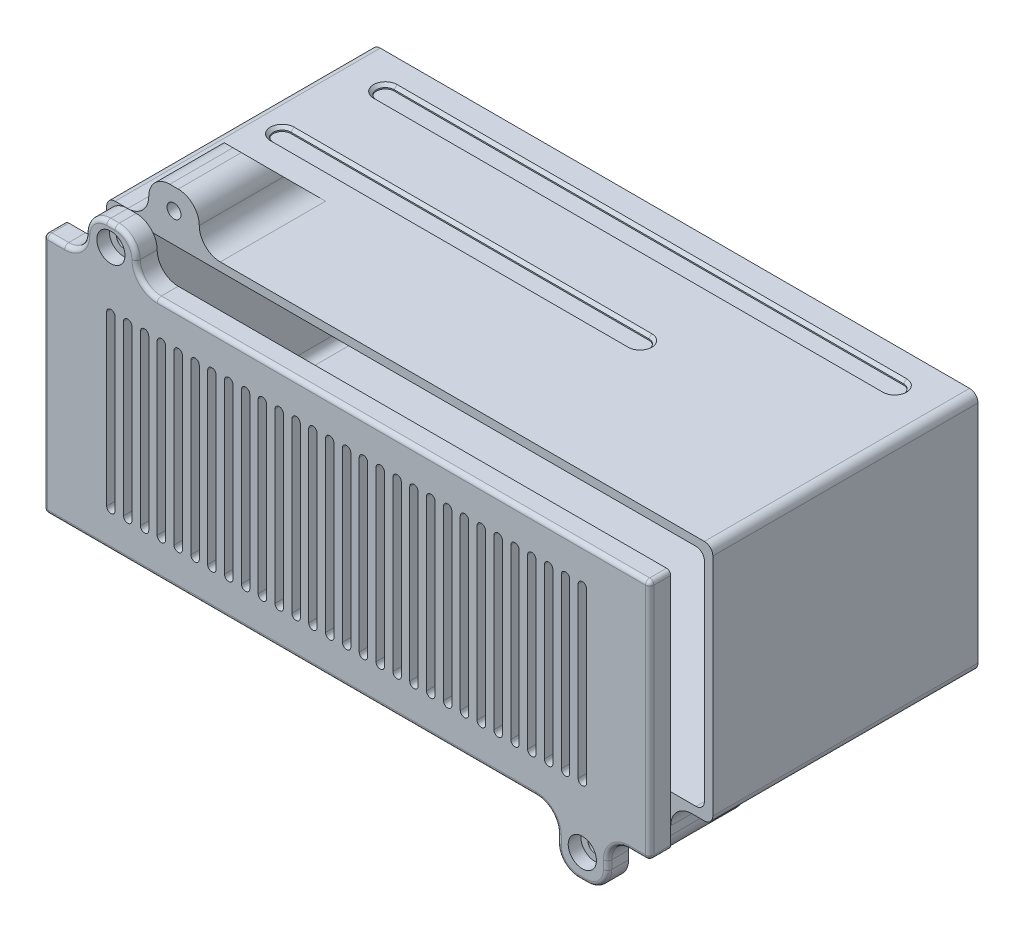
from build123d import *

# Parameters (mm, degrees)
SKETCH_1_W                = 144
SKETCH_1_H                = 57.5
EXTRUDE_1_DEPTH           = 67
CUT_EXTRUDE_START         = -5
SKETCH_2_W                = 140
SKETCH_2_H                = 53.5
CUT_EXTRUDE_1_DEPTH       = 98.467372856
SKETCH_3_R                = 5
EXTRUDE_2_DEPTH           = 8
CUT_EXTRUDE_2_DEPTH       = 6
SKETCH_5_R                = 1.75
CUT_EXTRUDE_4_DEPTH       = 103.467372856
SKETCH_15_W               = 12
SKETCH_15_H               = 12
EXTRUDE_4_DEPTH           = 25
CHAMFER_1_SIZE            = 10
CUT_EXTRUDE_9_DEPTH       = 107.459205802
CUT_EXTRUDE_9_DEPTH_BACK  = 25
SKETCH_17_R               = 1.65
CUT_EXTRUDE_10_DEPTH      = 21
FILLET_4_R                = 5
CUT_EXTRUDE_START_2       = -1
SKETCH_9_R                = 2
CUT_EXTRUDE_11_DEPTH      = 1
CUT_EXTRUDE_13_DEPTH      = 107.459205802
CUT_EXTRUDE_13_DEPTH_BACK = 107.459205802
CUT_EXTRUDE_14_DEPTH      = 107.459205802
EXTRUDE_5_DEPTH           = 3
EXTRUDE_5_DEPTH_BACK      = 15
CUT_EXTRUDE_15_DEPTH      = 107.459205802
CUT_EXTRUDE_START_3       = 2
CUT_EXTRUDE_16_DEPTH      = 2
SKETCH_25_W               = 52.627048612
SKETCH_25_H               = 3
EXTRUDE_6_DEPTH           = 1.6
SKETCH_26_W               = 6.080869006
SKETCH_26_H               = 2.6585681
CUT_EXTRUDE_17_DEPTH      = 3.8
EXTRUDE_7_DEPTH           = 5
CUT_EXTRUDE_START_4       = 5
SKETCH_27_3_R             = 1.65
CUT_EXTRUDE_18_DEPTH      = 5
SKETCH_27_4_W             = 135.6
SKETCH_27_4_H             = 49.1
CUT_EXTRUDE_19_DEPTH      = 3
SKETCH_27_5_W             = 139.6
SKETCH_27_5_H             = 53.1
SKETCH_27_5_W_2           = 135.6
SKETCH_27_5_H_2           = 49.1
EXTRUDE_8_DEPTH           = 1
FILLET_5_R                = 2
FILLET_6_R                = 1
CUT_EXTRUDE_21_DEPTH      = 1
CHAMFER_3_SIZE            = 0.7
SKETCH_27_9_R             = 3.35
CUT_EXTRUDE_22_DEPTH      = 11
SPLIT_BODIES_2_DEPTH      = 4
SPLIT_BODIES_2_2_DEPTH    = 2.024453747
FILLET_8_R                = 2


# Read off the part's stored shape, not the designer's step: Разделить2
# Some blends are built 0.0001 mm under size
with BuildPart() as part:
    # Эскиз1 → Бобышка-Вытянуть1 (new body)
    with BuildSketch(Plane.XY):
        Rectangle(SKETCH_1_W, SKETCH_1_H)
    extrude(amount=EXTRUDE_1_DEPTH)

    # Эскиз2 → Вырез-Вытянуть1 (cut, through all)
    with BuildSketch(Plane(origin=(0, 0, 0), x_dir=(-1, 0, 0), z_dir=(0, 0, -1)).offset(CUT_EXTRUDE_START)):
        Rectangle(SKETCH_2_W, SKETCH_2_H)
    extrude(amount=-CUT_EXTRUDE_1_DEPTH, mode=Mode.SUBTRACT)

    # Эскиз3 → Бобышка-Вытянуть2 (add)
    with BuildSketch(Plane(origin=(0, 0, 0), x_dir=(-1, 0, 0), z_dir=(0, 0, -1))):
        with Locations((66, -22)):
            Circle(SKETCH_3_R)
        with Locations((-66, -22)):
            Circle(SKETCH_3_R)
        with Locations((-66, 22)):
            Circle(SKETCH_3_R)
        with Locations((66, 22)):
            Circle(SKETCH_3_R)
    extrude(amount=-EXTRUDE_2_DEPTH)

    # Эскиз4 → Вырез-Вытянуть2 (cut)
    with BuildSketch(Plane(origin=(0, 0, 0), x_dir=(-1, 0, 0), z_dir=(0, 0, -1))):
        Polygon((-63.268024947, -20.755152361), (-65.712082153, -19.011616382), (-68.444057206, -20.256464022), (-68.731975053, -23.244847639), (-66.287917847, -24.988383618), (-63.555942794, -23.743535978), align=None)
        Polygon((63.002667596, -22.171265267), (64.64965387, -24.681398639), (67.646986274, -24.510133372), (68.997332404, -21.828734733), (67.35034613, -19.318601361), (64.353013726, -19.489866628), align=None)
        Polygon((63.002667596, 22.171265267), (64.353013726, 19.489866628), (67.35034613, 19.318601361), (68.997332404, 21.828734733), (67.646986274, 24.510133372), (64.64965387, 24.681398639), align=None)
        Polygon((-63.002667596, 22.171265267), (-64.64965387, 24.681398639), (-67.646986274, 24.510133372), (-68.997332404, 21.828734733), (-67.35034613, 19.318601361), (-64.353013726, 19.489866628), align=None)
    extrude(amount=-CUT_EXTRUDE_2_DEPTH, mode=Mode.SUBTRACT)

    # Эскиз5 → Вырез-Вытянуть4 (cut, through all)
    with BuildSketch(Plane(origin=(0, 0, 0), x_dir=(-1, 0, 0), z_dir=(0, 0, -1))):
        with Locations((-66, 22)):
            Circle(SKETCH_5_R)
        with Locations((-66, -22)):
            Circle(SKETCH_5_R)
        with Locations((66, -22)):
            Circle(SKETCH_5_R)
        with Locations((66, 22)):
            Circle(SKETCH_5_R)
    extrude(amount=-CUT_EXTRUDE_4_DEPTH, mode=Mode.SUBTRACT)

    # Эскиз15 → Бобышка-Вытянуть4 (add)
    with BuildSketch(Plane.XY.offset(67)):
        with Locations((56, -34.75)):
            Rectangle(SKETCH_15_W, SKETCH_15_H)
        with Locations((-56, 32.75)):
            Rectangle(SKETCH_15_W, SKETCH_15_H)
    extrude(amount=-EXTRUDE_4_DEPTH)

    # Фаска1
    chamfer_1_edges = [part.edges().sort_by_distance(p)[0] for p in [
        (-56, 38.75, 42),
        (56, -40.75, 42),
    ]]
    chamfer(chamfer_1_edges, length=CHAMFER_1_SIZE - 0.0001)  # a hair under: the kernel refuses the full size

    # Эскиз17 → Вырез-Вытянуть9 (cut, two sides: drawn at the far end of the back side and taken through both)
    with BuildSketch(Plane.XY.offset(67).offset(-CUT_EXTRUDE_9_DEPTH_BACK)):
        with Locations(Location((56, -34.75, 0), (0, 0, 90))):
            Circle(SKETCH_17_R)
        with Locations(Location((-56, 33.75, 0), (0, 0, 270))):
            Circle(SKETCH_17_R)
    extrude(amount=CUT_EXTRUDE_9_DEPTH + CUT_EXTRUDE_9_DEPTH_BACK, mode=Mode.SUBTRACT)

    # Эскиз18 → Вырез-Вытянуть10 (cut)
    with BuildSketch(Plane.XY.offset(67).offset(CUT_EXTRUDE_START)):
        Polygon((57.569806753, -32.190890762), (54.568649766, -32.110952854), (52.998843012, -34.670062091), (54.430193247, -37.309109238), (57.431350234, -37.389047146), (59.001156988, -34.829937909), align=None)
        Polygon((-57.5011107, 35.35), (-59.0022214, 32.75), (-57.5011107, 30.15), (-54.4988893, 30.15), (-52.9977786, 32.75), (-54.4988893, 35.35), align=None)
    extrude(amount=-CUT_EXTRUDE_10_DEPTH, mode=Mode.SUBTRACT)

    # Скругление4
    # the kernel refuses this fillet: 5 mm, written as the material it adds along each edge
    with BuildSketch(Plane(origin=(62, -28.75, 67), x_dir=(0, -1, 0), z_dir=(0, 0, -1))) as fillet_4_piece_1_section:
        with BuildLine():
            CenterArc((FILLET_4_R, -FILLET_4_R), FILLET_4_R, 90, 90)
            Line((0, -FILLET_4_R), (0, 0))
            Line((0, 0), (FILLET_4_R, 0))
        make_face()
    fillet_4_piece_1 = extrude(amount=25, mode=Mode.PRIVATE)
    fillet_4_piece_1 = split(fillet_4_piece_1, bisect_by=Plane(origin=(63.139504499, -36.600167795, 47.850067795), z_dir=(0, 0.7071067811865474, 0.7071067811865477)), keep=Keep.TOP, mode=Mode.PRIVATE)
    add(fillet_4_piece_1)
    with BuildSketch(Plane(origin=(50, -28.75, 67), x_dir=(-1, 0, 0), z_dir=(0, 0, -1))) as fillet_4_piece_2_section:
        with BuildLine():
            CenterArc((FILLET_4_R, -FILLET_4_R), FILLET_4_R, 90, 90)
            Line((0, -FILLET_4_R), (0, 0))
            Line((0, 0), (FILLET_4_R, 0))
        make_face()
    fillet_4_piece_2 = extrude(amount=25, mode=Mode.PRIVATE)
    fillet_4_piece_2 = split(fillet_4_piece_2, bisect_by=Plane(origin=(48.860495501, -36.600167796, 47.850067796), z_dir=(0, 0.7071067811865474, 0.7071067811865477)), keep=Keep.TOP, mode=Mode.PRIVATE)
    add(fillet_4_piece_2)
    with BuildSketch(Plane(origin=(-50, 28.75, 29.5), x_dir=(1, 0, 0), z_dir=(0, 0, 1))) as fillet_4_piece_3_section:
        with BuildLine():
            CenterArc((FILLET_4_R, FILLET_4_R), FILLET_4_R, 180, 90)
            Line((0, FILLET_4_R), (0, 0))
            Line((0, 0), (FILLET_4_R, 0))
        make_face()
    fillet_4_piece_3 = extrude(amount=37.5, mode=Mode.PRIVATE)
    fillet_4_piece_3 = split(fillet_4_piece_3, bisect_by=Plane(origin=(-47.550000008, 28.70005, 41.94995), z_dir=(0, -0.7071067811865474, 0.7071067811865477)), keep=Keep.TOP, mode=Mode.PRIVATE)
    add(fillet_4_piece_3)
    with BuildSketch(Plane(origin=(-62, 28.75, 67), x_dir=(-1, 0, 0), z_dir=(0, 0, -1))) as fillet_4_piece_4_section:
        with BuildLine():
            CenterArc((FILLET_4_R, FILLET_4_R), FILLET_4_R, 180, 90)
            Line((0, FILLET_4_R), (0, 0))
            Line((0, 0), (FILLET_4_R, 0))
        make_face()
    fillet_4_piece_4 = extrude(amount=37.5, mode=Mode.PRIVATE)
    fillet_4_piece_4 = split(fillet_4_piece_4, bisect_by=Plane(origin=(-63.160517803, 35.813690722, 49.063590722), z_dir=(0, -0.7071067811865474, 0.7071067811865477)), keep=Keep.TOP, mode=Mode.PRIVATE)
    add(fillet_4_piece_4)
    # the kernel refuses this fillet: 5 mm, written as the material it takes off along each edge
    with BuildSketch(Plane(origin=(-62, 38.75, 79.5), x_dir=(1, 0, 0), z_dir=(0, 0, -1)), Plane(origin=(-50, 38.75, 79.5), x_dir=(0, -1, 0), z_dir=(0, 0, -1))) as fillet_4_2_piece_1:
        with BuildLine():
            CenterArc((FILLET_4_R, FILLET_4_R), FILLET_4_R, 180, 90)
            Line((0, FILLET_4_R), (0, 0))
            Line((0, 0), (FILLET_4_R, 0))
        make_face()
    extrude(amount=40.0001, mode=Mode.SUBTRACT)
    with BuildSketch(Plane(origin=(62, -40.75, 79.5), x_dir=(0, 1, 0), z_dir=(0, 0, -1)), Plane(origin=(50, -40.75, 79.5), x_dir=(1, 0, 0), z_dir=(0, 0, -1))) as fillet_4_2_piece_2:
        with BuildLine():
            CenterArc((FILLET_4_R, -FILLET_4_R), FILLET_4_R, 90, 90)
            Line((0, -FILLET_4_R), (0, 0))
            Line((0, 0), (FILLET_4_R, 0))
        make_face()
    extrude(amount=40.0001, mode=Mode.SUBTRACT)

    # Эскиз9 → Вырез-Вытянуть11 (cut)
    with BuildSketch(Plane.XZ.offset(-26.75).offset(CUT_EXTRUDE_START_2)):
        with Locations(Location((-60.5, 12.3, 0), (0, 0, 270))):
            Circle(SKETCH_9_R)
        with Locations(Location((-55.5, 12.3, 0), (0, 0, 270))):
            Circle(SKETCH_9_R)
        with Locations(Location((-50.5, 12.3, 0), (0, 0, 270))):
            Circle(SKETCH_9_R)
        with Locations(Location((-45.5, 12.3, 0), (0, 0, 270))):
            Circle(SKETCH_9_R)
        with Locations(Location((-40.5, 12.3, 0), (0, 0, 270))):
            Circle(SKETCH_9_R)
        with Locations(Location((-35.5, 12.3, 0), (0, 0, 270))):
            Circle(SKETCH_9_R)
        with Locations(Location((-64, 33.3, 0), (0, 0, 270))):
            Circle(SKETCH_9_R)
        with Locations(Location((-59, 33.3, 0), (0, 0, 270))):
            Circle(SKETCH_9_R)
        with Locations(Location((-28.5, 12.3, 0), (0, 0, 270))):
            Circle(SKETCH_9_R)
        with Locations(Location((-23.5, 12.3, 0), (0, 0, 270))):
            Circle(SKETCH_9_R)
        with Locations(Location((-18.5, 12.3, 0), (0, 0, 270))):
            Circle(SKETCH_9_R)
        with Locations(Location((-13.5, 12.3, 0), (0, 0, 270))):
            Circle(SKETCH_9_R)
        with Locations(Location((-8.5, 12.3, 0), (0, 0, 270))):
            Circle(SKETCH_9_R)
        with Locations(Location((-3.5, 12.3, 0), (0, 0, 270))):
            Circle(SKETCH_9_R)
        with Locations(Location((3.5, 12.3, 0), (0, 0, 270))):
            Circle(SKETCH_9_R)
        with Locations(Location((8.5, 12.3, 0), (0, 0, 270))):
            Circle(SKETCH_9_R)
        with Locations(Location((13.5, 12.3, 0), (0, 0, 270))):
            Circle(SKETCH_9_R)
        with Locations(Location((18.5, 12.3, 0), (0, 0, 270))):
            Circle(SKETCH_9_R)
        with Locations(Location((23.5, 12.3, 0), (0, 0, 270))):
            Circle(SKETCH_9_R)
        with Locations(Location((28.5, 12.3, 0), (0, 0, 270))):
            Circle(SKETCH_9_R)
        with Locations(Location((35.5, 12.3, 0), (0, 0, 270))):
            Circle(SKETCH_9_R)
        with Locations(Location((40.5, 12.3, 0), (0, 0, 270))):
            Circle(SKETCH_9_R)
        with Locations(Location((45.5, 12.3, 0), (0, 0, 270))):
            Circle(SKETCH_9_R)
        with Locations(Location((50.5, 12.3, 0), (0, 0, 270))):
            Circle(SKETCH_9_R)
        with Locations(Location((55.5, 12.3, 0), (0, 0, 270))):
            Circle(SKETCH_9_R)
        with Locations(Location((60.5, 12.3, 0), (0, 0, 270))):
            Circle(SKETCH_9_R)
        with Locations(Location((-54, 33.3, 0), (0, 0, 270))):
            Circle(SKETCH_9_R)
        with Locations(Location((-49, 33.3, 0), (0, 0, 270))):
            Circle(SKETCH_9_R)
        with Locations(Location((-44, 33.3, 0), (0, 0, 270))):
            Circle(SKETCH_9_R)
        with Locations(Location((-39, 33.3, 0), (0, 0, 270))):
            Circle(SKETCH_9_R)
        with Locations(Location((-34, 33.3, 0), (0, 0, 270))):
            Circle(SKETCH_9_R)
        with Locations(Location((-29, 33.3, 0), (0, 0, 270))):
            Circle(SKETCH_9_R)
        with Locations(Location((-24, 33.3, 0), (0, 0, 270))):
            Circle(SKETCH_9_R)
        with Locations(Location((-19, 33.3, 0), (0, 0, 270))):
            Circle(SKETCH_9_R)
        with Locations(Location((-14, 33.3, 0), (0, 0, 270))):
            Circle(SKETCH_9_R)
        with Locations(Location((-9, 33.3, 0), (0, 0, 270))):
            Circle(SKETCH_9_R)
        with Locations(Location((-4, 33.3, 0), (0, 0, 270))):
            Circle(SKETCH_9_R)
        with Locations(Location((1, 33.3, 0), (0, 0, 270))):
            Circle(SKETCH_9_R)
        with Locations(Location((6, 33.3, 0), (0, 0, 270))):
            Circle(SKETCH_9_R)
        with Locations(Location((11, 33.3, 0), (0, 0, 270))):
            Circle(SKETCH_9_R)
        with Locations(Location((16, 33.3, 0), (0, 0, 270))):
            Circle(SKETCH_9_R)
        with Locations(Location((21, 33.3, 0), (0, 0, 270))):
            Circle(SKETCH_9_R)
    extrude(amount=-CUT_EXTRUDE_11_DEPTH, mode=Mode.SUBTRACT)

    # Эскиз19 → Вырез-Вытянуть13 (cut, two sides: drawn at the far end of the back side and taken through both)
    with BuildSketch(Plane(origin=(0, 0, 0), x_dir=(0, 0, -1), z_dir=(1, 0, 0)).offset(-CUT_EXTRUDE_13_DEPTH_BACK)):
        Polygon((0, -17.5), (-4, -17.5), (-4, 17.5), (-2, 17.5), (-2, 15.5), (-1, 14.5), (0, 14.5), align=None)
    extrude(amount=CUT_EXTRUDE_13_DEPTH + CUT_EXTRUDE_13_DEPTH_BACK, mode=Mode.SUBTRACT)

    # Эскиз20 → Вырез-Вытянуть14 (cut, through all)
    with BuildSketch(Plane(origin=(0, 0, 0), x_dir=(1, 0, 0), z_dir=(0, 1, 0))):
        Polygon((-25, -4), (-40, -4), (-40, -2.024453747), (-38, -2), (-38, 0), (-27, 0), (-27, -2), (-25, -2), align=None)
        Polygon((25, -2), (25, -4), (40, -4), (40, -2.024453747), (38, -2), (38, 0), (27, 0), (27, -2), align=None)
    extrude(amount=-CUT_EXTRUDE_14_DEPTH, mode=Mode.SUBTRACT)


with BuildPart() as body_2:
    # Эскиз21 → Бобышка-Вытянуть5 (new, two sides: drawn at the far end of the back side and taken through both)
    with BuildSketch(Plane.XZ.offset(28.75).offset(-EXTRUDE_5_DEPTH_BACK)):
        Polygon((37.772951388, 0), (27.2, 0), (27.2, 2.2), (25.2, 2.2), (25.2, 3.8), (39.819562997, 3.8), (39.8, 2.2), (37.799850509, 2.2), align=None)
    extrude(amount=EXTRUDE_5_DEPTH + EXTRUDE_5_DEPTH_BACK)

    # Эскиз22 → Вырез-Вытянуть15 (cut, through all)
    with BuildSketch(Plane(origin=(0, 0, 0), x_dir=(0, 0, -1), z_dir=(1, 0, 0))):
        Polygon((-2.2, -13.75), (-2.2, -15.84568202), (-4, -15.84568202), (-4, -11.595293693), (1.365124621, -11.595293693), (1.365124621, -15.500130707), (0, -15.500130707), (-1.535688468, -13.75), align=None)
    extrude(amount=CUT_EXTRUDE_15_DEPTH, mode=Mode.SUBTRACT)


with BuildPart() as cut_extrude_16_tool:
    # Эскиз24 → Вырез-Вытянуть16 (new body)
    with BuildSketch(Plane.XY.offset(CUT_EXTRUDE_START_3)):
        Polygon((39.8, -27.25), (39.8, -19), (59.8, -21.625), (59.8, -24.625), align=None)
        Polygon((25.172951388, -27.25), (25.172951388, -19), (5.172951388, -21.625), (5.172951388, -24.625), align=None)
        Polygon((-25.172951388, -27.25), (-25.172951388, -19), (-5.172951388, -21.625), (-5.172951388, -24.625), align=None)
        Polygon((-39.8, -27.25), (-39.8, -19), (-59.8, -21.625), (-59.8, -24.625), align=None)
    extrude(amount=CUT_EXTRUDE_16_DEPTH)


with BuildPart() as part_1:
    add(part.part)

    # Вырез-Вытянуть16: cut by cut_extrude_16_tool
    add(cut_extrude_16_tool.part, mode=Mode.SUBTRACT)

    # Скругление5
    # the kernel refuses this fillet: 2 mm, written as the material it adds along each edge
    with BuildSketch(Plane(origin=(70, -26.75, 0), x_dir=(0, 1, 0), z_dir=(0, 0, 1)), Plane(origin=(-70, -26.75, 0), x_dir=(1, 0, 0), z_dir=(0, 0, 1))) as fillet_5_piece_1:
        with BuildLine():
            CenterArc((FILLET_5_R, FILLET_5_R), FILLET_5_R, 180, 90)
            Line((0, FILLET_5_R), (0, 0))
            Line((0, 0), (FILLET_5_R, 0))
        make_face()
    extrude(amount=67)
    with BuildSketch(Plane(origin=(-70, 26.75, 0), x_dir=(1, 0, 0), z_dir=(0, 0, 1)), Plane(origin=(70, 26.75, 0), x_dir=(0, -1, 0), z_dir=(0, 0, 1))) as fillet_5_piece_2:
        with BuildLine():
            CenterArc((FILLET_5_R, -FILLET_5_R), FILLET_5_R, 90, 90)
            Line((0, -FILLET_5_R), (0, 0))
            Line((0, 0), (FILLET_5_R, 0))
        make_face()
    extrude(amount=67)
    # the kernel refuses this fillet: 2 mm, written as the material it takes off along each edge
    with BuildSketch(Plane(origin=(72, -28.75, -5), x_dir=(0, 1, 0), z_dir=(0, 0, 1)), Plane(origin=(-72, -28.75, -5), x_dir=(1, 0, 0), z_dir=(0, 0, 1)), Plane(origin=(72, 28.75, -5), x_dir=(-1, 0, 0), z_dir=(0, 0, 1))) as fillet_5_2_piece_1:
        with BuildLine():
            CenterArc((FILLET_5_R, FILLET_5_R), FILLET_5_R, 180, 90)
            Line((0, FILLET_5_R), (0, 0))
            Line((0, 0), (FILLET_5_R, 0))
        make_face()
    extrude(amount=77, mode=Mode.SUBTRACT)
    with BuildSketch(Plane(origin=(-72, 28.75, -5), x_dir=(1, 0, 0), z_dir=(0, 0, 1))) as fillet_5_2_piece_2:
        with BuildLine():
            CenterArc((FILLET_5_R, -FILLET_5_R), FILLET_5_R, 90, 90)
            Line((0, -FILLET_5_R), (0, 0))
            Line((0, 0), (FILLET_5_R, 0))
        make_face()
    extrude(amount=77, mode=Mode.SUBTRACT)

    # Эскиз28 → Вырез-Вытянуть21 (cut)
    with BuildSketch(Plane(origin=(0, 28.75, 0), x_dir=(1, 0, 0), z_dir=(0, 1, 0))):
        with BuildLine():
            Line((60.5, -14.4), (-60.5, -14.4))
            ThreePointArc((-60.5, -14.4), (-62.6, -12.3), (-60.5, -10.2))
            Line((-60.5, -10.2), (60.5, -10.2))
            ThreePointArc((60.5, -10.2), (62.6, -12.3), (60.5, -14.4))
        make_face()
        with BuildLine():
            Line((21, -35.4), (-64, -35.4))
            ThreePointArc((-64, -35.4), (-66.1, -33.3), (-64, -31.2))
            Line((-64, -31.2), (21, -31.2))
            ThreePointArc((21, -31.2), (23.1, -33.3), (21, -35.4))
        make_face()
    extrude(amount=-CUT_EXTRUDE_21_DEPTH, mode=Mode.SUBTRACT)

    # Фаска3
    chamfer_3_edges = [part_1.edges().sort_by_distance(p)[0] for p in [
        (62.6, 28.75, 12.3),
        (0, 28.75, 10.2),
        (-62.6, 28.75, 12.3),
        (0, 28.75, 14.4),
        (23.1, 28.75, 33.3),
        (-21.5, 28.75, 31.2),
        (-66.1, 28.75, 33.3),
        (-21.5, 28.75, 35.4),
    ]]
    chamfer(chamfer_3_edges, length=CHAMFER_3_SIZE)

    # Split Bodies 2 outline → Split Bodies 2 (cut)
    # profile 1 of 4: a face of its own
    with BuildSketch(Plane.XY):
        Polygon((-27, -17.5), (-27, -28.75), (25, -28.75), (25, -27.22730013), (5.172951388, -24.625), (5.172951388, -21.625), (25, -19.02269987), (25, -17.5), align=None)
    # profile 2 of 4: a face of its own
    with BuildSketch(Plane.XY):
        with BuildLine():
            Line((-38, -28.75), (-38, -17.5))
            Line((-38, -17.5), (-72, -17.5))
            Line((-72, -17.5), (-72, -26.75))
            ThreePointArc((-72, -26.75), (-71.414213562, -28.164213562), (-70, -28.75))
            Line((-70, -28.75), (-38, -28.75))
        make_face()
        Polygon((-64.64965387, -24.681398639), (-67.646986274, -24.510133372), (-68.997332404, -21.828734733), (-67.35034613, -19.318601361), (-64.353013726, -19.489866628), (-63.002667596, -22.171265267), align=None, mode=Mode.SUBTRACT)
    # profile 3 of 4: a face of its own
    with BuildSketch(Plane.XY):
        with BuildLine():
            Line((40, -27.22375), (40, -28.75))
            Line((40, -28.75), (70, -28.75))
            ThreePointArc((70, -28.75), (71.414213562, -28.164213562), (72, -26.75))
            Line((72, -26.75), (72, -17.5))
            Line((72, -17.5), (40, -17.5))
            Line((40, -17.5), (40, -19.02625))
            Line((40, -19.02625), (59.8, -21.625))
            Line((59.8, -21.625), (59.8, -24.625))
            Line((59.8, -24.625), (40, -27.22375))
        make_face()
        Polygon((63.555942794, -23.743535978), (63.268024947, -20.755152361), (65.712082153, -19.011616382), (68.444057206, -20.256464022), (68.731975053, -23.244847639), (66.287917847, -24.988383618), align=None, mode=Mode.SUBTRACT)
    # profile 4 of 4: a face of its own
    with BuildSketch(Plane.XY):
        with BuildLine():
            Line((-72, 14.5), (72, 14.5))
            Line((72, 14.5), (72, 26.75))
            ThreePointArc((72, 26.75), (71.414213562, 28.164213562), (70, 28.75))
            Line((70, 28.75), (-70, 28.75))
            ThreePointArc((-70, 28.75), (-71.414213562, 28.164213562), (-72, 26.75))
            Line((-72, 26.75), (-72, 14.5))
        make_face()
        Polygon((63.002667596, 22.171265267), (64.64965387, 24.681398639), (67.646986274, 24.510133372), (68.997332404, 21.828734733), (67.35034613, 19.318601361), (64.353013726, 19.489866628), align=None, mode=Mode.SUBTRACT)
        Polygon((-64.64965387, 24.681398639), (-63.002667596, 22.171265267), (-64.353013726, 19.489866628), (-67.35034613, 19.318601361), (-68.997332404, 21.828734733), (-67.646986274, 24.510133372), align=None, mode=Mode.SUBTRACT)
    extrude(amount=SPLIT_BODIES_2_DEPTH, mode=Mode.SUBTRACT)

    # Split Bodies 2 2 outline → Split Bodies 2 2 (cut)
    with BuildSketch(Plane.XY):
        Polygon((25, -27.22730013), (25, -28.75), (27, -28.75), (27, -17.5), (25, -17.5), (25, -19.02269987), (5.172951388, -21.625), (5.172951388, -24.625), align=None)
        Polygon((38, -17.5), (38, -28.75), (40, -28.75), (40, -27.22375), (59.8, -24.625), (59.8, -21.625), (40, -19.02625), (40, -17.5), align=None)
    extrude(amount=SPLIT_BODIES_2_2_DEPTH, mode=Mode.SUBTRACT)


with BuildPart() as body_2_1:
    add(body_2.part)

    # Вырез-Вытянуть16: cut by cut_extrude_16_tool
    add(cut_extrude_16_tool.part, mode=Mode.SUBTRACT)

    # Эскиз25 → Бобышка-Вытянуть6 (add)
    with BuildSketch(Plane(origin=(0, 0, 2.2), x_dir=(-1, 0, 0), z_dir=(0, 0, -1))):
        with Locations((-32.486475694, -23.125)):
            Rectangle(SKETCH_25_W, SKETCH_25_H)
    extrude(amount=-EXTRUDE_6_DEPTH)

    # Эскиз26 → Вырез-Вытянуть17 (cut)
    with BuildSketch(Plane(origin=(0, 0, 0), x_dir=(-1, 0, 0), z_dir=(0, 0, -1))):
        with Locations((-32.486475694, -28.670303883)):
            Rectangle(SKETCH_26_W, SKETCH_26_H)
    extrude(amount=-CUT_EXTRUDE_17_DEPTH, mode=Mode.SUBTRACT)


with BuildPart() as body_3:
    # Эскиз27 → Бобышка-Вытянуть7 (new body)
    with BuildSketch(Plane.XY.offset(77)):
        with BuildLine():
            Line((-67, 28.75), (-72, 28.75))
            Line((-72, 28.75), (-72, -28.75))
            Line((-72, -28.75), (45, -28.75))
            ThreePointArc((45, -28.75), (48.535533906, -30.214466094), (50, -33.75))
            Line((50, -33.75), (50, -35.75))
            ThreePointArc((50, -35.75), (51.464466094, -39.285533906), (55, -40.75))
            Line((55, -40.75), (57, -40.75))
            ThreePointArc((57, -40.75), (60.535533906, -39.285533906), (62, -35.75))
            Line((62, -35.75), (62, -33.75))
            ThreePointArc((62, -33.75), (63.464466094, -30.214466094), (67, -28.75))
            Line((67, -28.75), (72, -28.75))
            Line((72, -28.75), (72, 28.75))
            Line((72, 28.75), (-45, 28.75))
            ThreePointArc((-45, 28.75), (-48.535533906, 30.214466094), (-50, 33.75))
            ThreePointArc((-50, 33.75), (-51.464466094, 37.285533906), (-55, 38.75))
            Line((-55, 38.75), (-57, 38.75))
            ThreePointArc((-57, 38.75), (-60.535533906, 37.285533906), (-62, 33.75))
            ThreePointArc((-62, 33.75), (-63.464466094, 30.214466094), (-67, 28.75))
        make_face()
    extrude(amount=EXTRUDE_7_DEPTH)

    # Эскиз27<3> → Вырез-Вытянуть18 (cut)
    with BuildSketch(Plane.XY.offset(77).offset(CUT_EXTRUDE_START_4)):
        with Locations((56, -34.75)):
            Circle(SKETCH_27_3_R)
        with Locations((-56, 33.75)):
            Circle(SKETCH_27_3_R)
        with BuildLine():
            Line((1, 20), (1, -20))
            ThreePointArc((1, -20), (0, -21), (-1, -20))
            Line((-1, -20), (-1, 20))
            ThreePointArc((-1, 20), (0, 21), (1, 20))
        make_face()
        with BuildLine():
            Line((5, 20), (5, -20))
            ThreePointArc((5, -20), (4, -21), (3, -20))
            Line((3, -20), (3, 20))
            ThreePointArc((3, 20), (4, 21), (5, 20))
        make_face()
        with BuildLine():
            Line((9, 20), (9, -20))
            ThreePointArc((9, -20), (8, -21), (7, -20))
            Line((7, -20), (7, 20))
            ThreePointArc((7, 20), (8, 21), (9, 20))
        make_face()
        with BuildLine():
            Line((13, 20), (13, -20))
            ThreePointArc((13, -20), (12, -21), (11, -20))
            Line((11, -20), (11, 20))
            ThreePointArc((11, 20), (12, 21), (13, 20))
        make_face()
        with BuildLine():
            Line((17, 20), (17, -20))
            ThreePointArc((17, -20), (16, -21), (15, -20))
            Line((15, -20), (15, 20))
            ThreePointArc((15, 20), (16, 21), (17, 20))
        make_face()
        with BuildLine():
            Line((21, 20), (21, -20))
            ThreePointArc((21, -20), (20, -21), (19, -20))
            Line((19, -20), (19, 20))
            ThreePointArc((19, 20), (20, 21), (21, 20))
        make_face()
        with BuildLine():
            Line((25, 20), (25, -20))
            ThreePointArc((25, -20), (24, -21), (23, -20))
            Line((23, -20), (23, 20))
            ThreePointArc((23, 20), (24, 21), (25, 20))
        make_face()
        with BuildLine():
            Line((29, 20), (29, -20))
            ThreePointArc((29, -20), (28, -21), (27, -20))
            Line((27, -20), (27, 20))
            ThreePointArc((27, 20), (28, 21), (29, 20))
        make_face()
        with BuildLine():
            Line((33, 20), (33, -20))
            ThreePointArc((33, -20), (32, -21), (31, -20))
            Line((31, -20), (31, 20))
            ThreePointArc((31, 20), (32, 21), (33, 20))
        make_face()
        with BuildLine():
            Line((37, 20), (37, -20))
            ThreePointArc((37, -20), (36, -21), (35, -20))
            Line((35, -20), (35, 20))
            ThreePointArc((35, 20), (36, 21), (37, 20))
        make_face()
        with BuildLine():
            Line((41, 20), (41, -20))
            ThreePointArc((41, -20), (40, -21), (39, -20))
            Line((39, -20), (39, 20))
            ThreePointArc((39, 20), (40, 21), (41, 20))
        make_face()
        with BuildLine():
            Line((45, 20), (45, -20))
            ThreePointArc((45, -20), (44, -21), (43, -20))
            Line((43, -20), (43, 20))
            ThreePointArc((43, 20), (44, 21), (45, 20))
        make_face()
        with BuildLine():
            Line((49, 20), (49, -20))
            ThreePointArc((49, -20), (48, -21), (47, -20))
            Line((47, -20), (47, 20))
            ThreePointArc((47, 20), (48, 21), (49, 20))
        make_face()
        with BuildLine():
            Line((53, 20), (53, -20))
            ThreePointArc((53, -20), (52, -21), (51, -20))
            Line((51, -20), (51, 20))
            ThreePointArc((51, 20), (52, 21), (53, 20))
        make_face()
        with BuildLine():
            Line((57, 20), (57, -20))
            ThreePointArc((57, -20), (56, -21), (55, -20))
            Line((55, -20), (55, 20))
            ThreePointArc((55, 20), (56, 21), (57, 20))
        make_face()
        with BuildLine():
            Line((-3, 20), (-3, -20))
            ThreePointArc((-3, -20), (-4, -21), (-5, -20))
            Line((-5, -20), (-5, 20))
            ThreePointArc((-5, 20), (-4, 21), (-3, 20))
        make_face()
        with BuildLine():
            Line((-7, 20), (-7, -20))
            ThreePointArc((-7, -20), (-8, -21), (-9, -20))
            Line((-9, -20), (-9, 20))
            ThreePointArc((-9, 20), (-8, 21), (-7, 20))
        make_face()
        with BuildLine():
            Line((-11, 20), (-11, -20))
            ThreePointArc((-11, -20), (-12, -21), (-13, -20))
            Line((-13, -20), (-13, 20))
            ThreePointArc((-13, 20), (-12, 21), (-11, 20))
        make_face()
        with BuildLine():
            Line((-15, 20), (-15, -20))
            ThreePointArc((-15, -20), (-16, -21), (-17, -20))
            Line((-17, -20), (-17, 20))
            ThreePointArc((-17, 20), (-16, 21), (-15, 20))
        make_face()
        with BuildLine():
            Line((-19, 20), (-19, -20))
            ThreePointArc((-19, -20), (-20, -21), (-21, -20))
            Line((-21, -20), (-21, 20))
            ThreePointArc((-21, 20), (-20, 21), (-19, 20))
        make_face()
        with BuildLine():
            Line((-23, 20), (-23, -20))
            ThreePointArc((-23, -20), (-24, -21), (-25, -20))
            Line((-25, -20), (-25, 20))
            ThreePointArc((-25, 20), (-24, 21), (-23, 20))
        make_face()
        with BuildLine():
            Line((-27, 20), (-27, -20))
            ThreePointArc((-27, -20), (-28, -21), (-29, -20))
            Line((-29, -20), (-29, 20))
            ThreePointArc((-29, 20), (-28, 21), (-27, 20))
        make_face()
        with BuildLine():
            Line((-31, 20), (-31, -20))
            ThreePointArc((-31, -20), (-32, -21), (-33, -20))
            Line((-33, -20), (-33, 20))
            ThreePointArc((-33, 20), (-32, 21), (-31, 20))
        make_face()
        with BuildLine():
            Line((-35, 20), (-35, -20))
            ThreePointArc((-35, -20), (-36, -21), (-37, -20))
            Line((-37, -20), (-37, 20))
            ThreePointArc((-37, 20), (-36, 21), (-35, 20))
        make_face()
        with BuildLine():
            Line((-39, 20), (-39, -20))
            ThreePointArc((-39, -20), (-40, -21), (-41, -20))
            Line((-41, -20), (-41, 20))
            ThreePointArc((-41, 20), (-40, 21), (-39, 20))
        make_face()
        with BuildLine():
            Line((-43, 20), (-43, -20))
            ThreePointArc((-43, -20), (-44, -21), (-45, -20))
            Line((-45, -20), (-45, 20))
            ThreePointArc((-45, 20), (-44, 21), (-43, 20))
        make_face()
        with BuildLine():
            Line((-47, 20), (-47, -20))
            ThreePointArc((-47, -20), (-48, -21), (-49, -20))
            Line((-49, -20), (-49, 20))
            ThreePointArc((-49, 20), (-48, 21), (-47, 20))
        make_face()
        with BuildLine():
            Line((-51, 20), (-51, -20))
            ThreePointArc((-51, -20), (-52, -21), (-53, -20))
            Line((-53, -20), (-53, 20))
            ThreePointArc((-53, 20), (-52, 21), (-51, 20))
        make_face()
        with BuildLine():
            Line((-55, 20), (-55, -20))
            ThreePointArc((-55, -20), (-56, -21), (-57, -20))
            Line((-57, -20), (-57, 20))
            ThreePointArc((-57, 20), (-56, 21), (-55, 20))
        make_face()
    extrude(amount=-CUT_EXTRUDE_18_DEPTH, mode=Mode.SUBTRACT)

    # Эскиз27<4> → Вырез-Вытянуть19 (cut)
    with BuildSketch(Plane.XY.offset(77)):
        Rectangle(SKETCH_27_4_W, SKETCH_27_4_H)
    extrude(amount=CUT_EXTRUDE_19_DEPTH, mode=Mode.SUBTRACT)

    # Эскиз27<5> → Бобышка-Вытянуть8 (add)
    with BuildSketch(Plane.XY.offset(77)):
        Rectangle(SKETCH_27_5_W, SKETCH_27_5_H)
        Rectangle(SKETCH_27_5_W_2, SKETCH_27_5_H_2, mode=Mode.SUBTRACT)
    extrude(amount=-EXTRUDE_8_DEPTH)

    # Скругление6
    fillet_6_edges = [body_3.edges().sort_by_distance(p)[0] for p in [
        (63.464466094, -30.214466094, 82),
        (62, -34.75, 82),
        (60.535533906, -39.285533906, 82),
        (56, -40.75, 82),
        (51.464466094, -39.285533906, 82),
        (72, 28.75, 79.5),
        (-72, 28.75, 79.5),
        (-72, -28.75, 79.5),
        (72, -28.75, 79.5),
        (50, -34.75, 82),
        (48.535533906, -30.214466094, 82),
        (-13.5, -28.75, 82),
        (-72, 0, 82),
        (-69.5, 28.75, 82),
        (72, 0, 82),
        (-63.464466094, 30.214466094, 82),
        (-60.535533906, 37.285533906, 82),
        (-56, 38.75, 82),
        (-51.464466094, 37.285533906, 82),
        (-48.535533906, 30.214466094, 82),
        (13.5, 28.75, 82),
        (69.5, -28.75, 82),
    ]]
    fillet(fillet_6_edges, radius=FILLET_6_R)

    # Эскиз27<9> → Вырез-Вытянуть22 (cut)
    with BuildSketch(Plane.XY.offset(77).offset(CUT_EXTRUDE_START_3)):
        with Locations((-56, 33.75)):
            Circle(SKETCH_27_9_R)
        with Locations((56, -34.75)):
            Circle(SKETCH_27_9_R)
    extrude(amount=CUT_EXTRUDE_22_DEPTH, mode=Mode.SUBTRACT)

    # Скругление8
    fillet_8_edges = [body_3.edges().sort_by_distance(p)[0] for p in [
        (67.8, -24.55, 78),
        (67.8, 24.55, 78),
        (-67.8, 24.55, 78),
        (-67.8, -24.55, 78),
        (69.8, 26.55, 76.5),
        (69.8, -26.55, 76.5),
        (-69.8, -26.55, 76.5),
        (-69.8, 26.55, 76.5),
    ]]
    fillet(fillet_8_edges, radius=FILLET_8_R)


solid = Compound([part_1.part, body_2_1.part, body_3.part])
